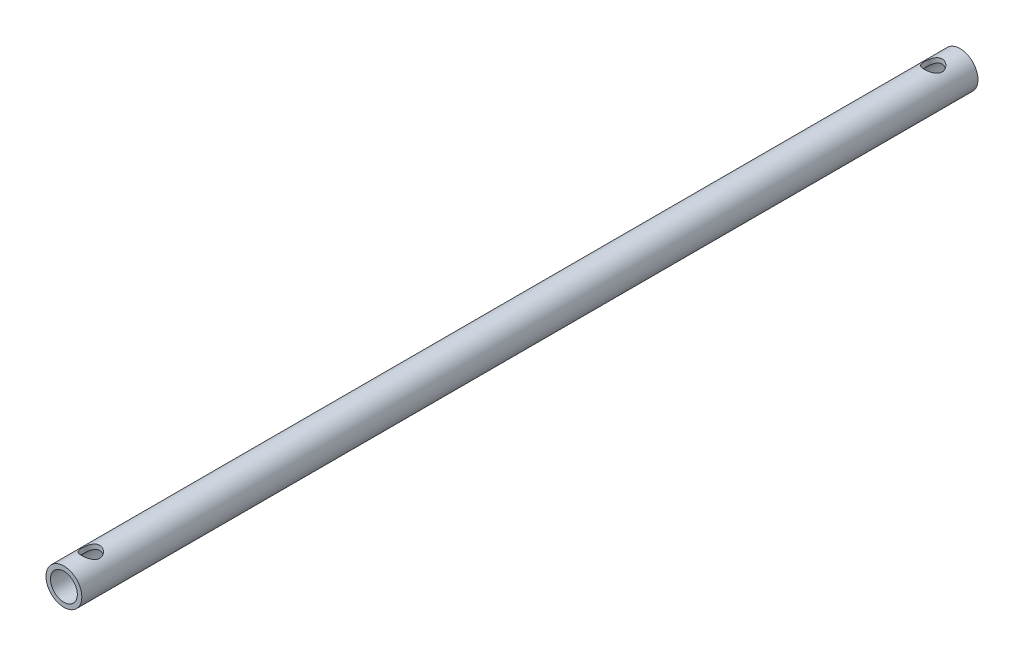
from build123d import *

# Parameters (mm, degrees)
ESQUISSE1_R             = 2
ESQUISSE1_R_2           = 1.5
BOSS_EXTRU_1_DEPTH      = 100
ESQUISSE2_R             = 1
ENL_V_MAT_EXTRU_1_DEPTH = 101.318797064


with BuildPart() as part:
    # Esquisse1 → Boss.-Extru.1 (new body)
    with BuildSketch(Plane.XY):
        with Locations((-4.918167702, 1.104491281)):
            Circle(ESQUISSE1_R)
        with Locations((-4.918167702, 1.104491281)):
            Circle(ESQUISSE1_R_2, mode=Mode.SUBTRACT)
    extrude(amount=BOSS_EXTRU_1_DEPTH)

    # Esquisse2 → Enlèv. mat.-Extru.1 (cut, through all)
    with BuildSketch(Plane(origin=(0, 3.104491281, 0), x_dir=(1, 0, 0), z_dir=(0, 1, 0))):
        with Locations((-4.918167702, -3)):
            Circle(ESQUISSE2_R)
        with Locations((-4.918167702, -97)):
            Circle(ESQUISSE2_R)
    extrude(amount=-ENL_V_MAT_EXTRU_1_DEPTH, mode=Mode.SUBTRACT)


solid = part.part
